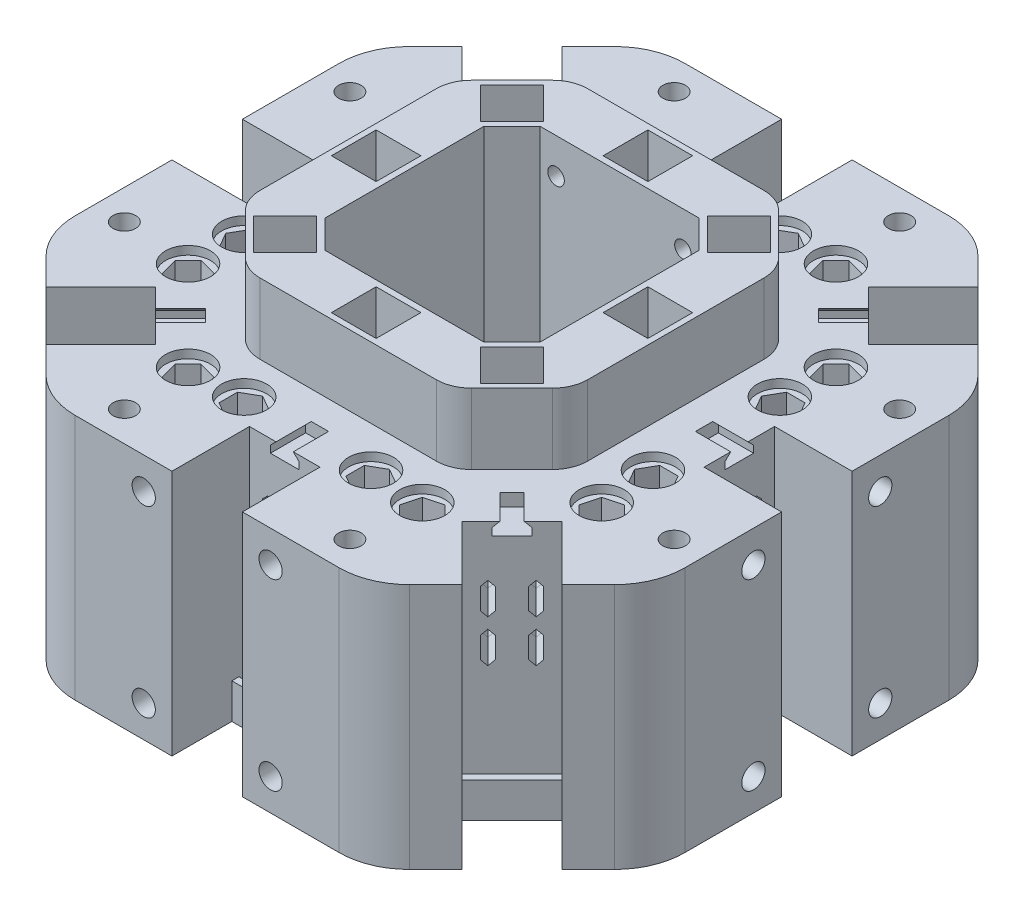
from build123d import *

# Parameters (mm, degrees)
EXTRUDE_1_DEPTH          = 35
SKETCH_4_R               = 1.375
CUT_EXTRUDE_1_DEPTH      = 71.470738608
CUT_EXTRUDE_3_DEPTH      = 5
SKETCH_9_R               = 3.19
CUT_EXTRUDE_4_DEPTH      = 1.2
SKETCH_5_W               = 10
SKETCH_5_H               = 11
SKETCH_5_W_2             = 11
SKETCH_5_H_2             = 10
CUT_EXTRUDE_2_DEPTH      = 71.470738608
EXTRUDE_2_DEPTH          = 10
SKETCH_11_W              = 6.35
SKETCH_11_H              = 6.35
CUT_EXTRUDE_5_DEPTH      = 6.5
SKETCH_12_W              = 6.35
SKETCH_12_H              = 6.35
CUT_EXTRUDE_6_DEPTH      = 6.5
SKETCH_13_W              = 4.05
SKETCH_13_H              = 1.5
SKETCH_13_H_2            = 3.5
CUT_EXTRUDE_7_DEPTH      = 1.8
EXTRUDE_3_DEPTH          = 5
EXTRUDE_4_DEPTH          = 5
PATTERN_CIRCULAR_1_COUNT = 4
PATTERN_CIRCULAR_2_COUNT = 4
CUT_EXTRUDE_9_DEPTH      = 76.935005103
EXTRUDE_5_DEPTH          = 4
CHAMFER_1_SIZE           = 2.5
SKETCH_25_R              = 1.175
CUT_EXTRUDE_11_DEPTH     = 76.935005103
SKETCH_28_R              = 1.6
CUT_EXTRUDE_13_DEPTH     = 6
SKETCH_30_R              = 1.175
CUT_EXTRUDE_14_DEPTH     = 20
SKETCH_31_R              = 2.1
CUT_EXTRUDE_15_DEPTH     = 1.5
FILLET_1_R               = 10
FILLET_2_R               = 5
SKETCH_33_R              = 1.65
CUT_EXTRUDE_16_DEPTH     = 5
PATTERN_CIRCULAR_3_COUNT = 4
SKETCH_34_W              = 10
SKETCH_34_H              = 1
EXTRUDE_6_DEPTH          = 5


with BuildPart() as part:
    # 草图3 → 凸台-拉伸1 (new body)
    with BuildSketch(Plane(origin=(0, 0, 0), x_dir=(1, 0, 0), z_dir=(0, 1, 0))):
        Polygon((43.25, -22.864484041), (22.864484041, -43.25), (-22.864484041, -43.25), (-43.25, -22.864484041), (-43.25, 22.864484041), (-22.864484041, 43.25), (22.864484041, 43.25), (43.25, 22.864484041), align=None)
    extrude(amount=EXTRUDE_1_DEPTH)

    # 草图4 → 切除-拉伸1 (cut, through all)
    with BuildSketch(Plane(origin=(0, 35, 0), x_dir=(1, 0, 0), z_dir=(0, 1, 0))):
        with Locations(Location((9, -29, 0), (0, 0, 270))):
            Circle(SKETCH_4_R)
        with Locations(Location((-9, -29, 0), (0, 0, 90))):
            Circle(SKETCH_4_R)
        with Locations(Location((29.344931419, -16.617009358, 0), (0, 0, 270))):
            Circle(SKETCH_4_R)
        with Locations(Location((16.617009358, -29.344931419, 0), (0, 0, 90))):
            Circle(SKETCH_4_R)
        with Locations(Location((-29.344931419, -16.617009358, 0), (0, 0, 90))):
            Circle(SKETCH_4_R)
        with Locations(Location((-16.617009358, -29.344931419, 0), (0, 0, 270))):
            Circle(SKETCH_4_R)
        with Locations(Location((-29, -9, 0), (0, 0, 270))):
            Circle(SKETCH_4_R)
        with Locations(Location((-29, 9, 0), (0, 0, 90))):
            Circle(SKETCH_4_R)
        with Locations(Location((-16.617009358, 29.344931419, 0), (0, 0, 90))):
            Circle(SKETCH_4_R)
        with Locations(Location((-29.344931419, 16.617009358, 0), (0, 0, 270))):
            Circle(SKETCH_4_R)
        with Locations(Location((-9, 29, 0), (0, 0, 270))):
            Circle(SKETCH_4_R)
        with Locations(Location((9, 29, 0), (0, 0, 90))):
            Circle(SKETCH_4_R)
        with Locations(Location((29.344931419, 16.617009358, 0), (0, 0, 90))):
            Circle(SKETCH_4_R)
        with Locations(Location((16.617009358, 29.344931419, 0), (0, 0, 270))):
            Circle(SKETCH_4_R)
        with Locations(Location((29, 9, 0), (0, 0, 270))):
            Circle(SKETCH_4_R)
        with Locations(Location((29, -9, 0), (0, 0, 90))):
            Circle(SKETCH_4_R)
    extrude(amount=-CUT_EXTRUDE_1_DEPTH, mode=Mode.SUBTRACT)

    # 草图8 → 切除-拉伸3 (cut)
    with BuildSketch(Plane(origin=(0, 35, 0), x_dir=(1, 0, 0), z_dir=(0, 1, 0))):
        Polygon((-6.735, -30.30769836), (-9, -31.615396719), (-11.265, -30.30769836), (-11.265, -27.69230164), (-9, -26.384603281), (-6.735, -27.69230164), align=None)
        Polygon((9, -26.384603281), (6.735, -27.69230164), (6.735, -30.30769836), (9, -31.615396719), (11.265, -30.30769836), (11.265, -27.69230164), align=None)
        Polygon((14.767644602, -27.495566663), (14.090730121, -30.021845901), (15.940094876, -31.871210657), (18.466374114, -31.194296175), (19.143288595, -28.668016938), (17.293923839, -26.818652182), align=None)
        Polygon((31.194296175, -18.466374114), (28.668016938, -19.143288595), (26.818652182, -17.293923839), (27.495566663, -14.767644602), (30.021845901, -14.090730121), (31.871210657, -15.940094876), align=None)
        Polygon((-27.69230164, 6.735), (-30.30769836, 6.735), (-31.615396719, 9), (-30.30769836, 11.265), (-27.69230164, 11.265), (-26.384603281, 9), align=None)
        Polygon((-30.30769836, -11.265), (-27.69230164, -11.265), (-26.384603281, -9), (-27.69230164, -6.735), (-30.30769836, -6.735), (-31.615396719, -9), align=None)
        Polygon((-31.194296175, -18.466374114), (-28.668016938, -19.143288595), (-26.818652182, -17.293923839), (-27.495566663, -14.767644602), (-30.021845901, -14.090730121), (-31.871210657, -15.940094876), align=None)
        Polygon((-18.466374114, -31.194296175), (-19.143288595, -28.668016938), (-17.293923839, -26.818652182), (-14.767644602, -27.495566663), (-14.090730121, -30.021845901), (-15.940094876, -31.871210657), align=None)
        Polygon((6.735, 27.69230164), (6.735, 30.30769836), (9, 31.615396719), (11.265, 30.30769836), (11.265, 27.69230164), (9, 26.384603281), align=None)
        Polygon((-11.265, 30.30769836), (-11.265, 27.69230164), (-9, 26.384603281), (-6.735, 27.69230164), (-6.735, 30.30769836), (-9, 31.615396719), align=None)
        Polygon((-18.466374114, 31.194296175), (-19.143288595, 28.668016938), (-17.293923839, 26.818652182), (-14.767644602, 27.495566663), (-14.090730121, 30.021845901), (-15.940094876, 31.871210657), align=None)
        Polygon((-31.194296175, 18.466374114), (-28.668016938, 19.143288595), (-26.818652182, 17.293923839), (-27.495566663, 14.767644602), (-30.021845901, 14.090730121), (-31.871210657, 15.940094876), align=None)
        Polygon((27.69230164, -6.735), (30.30769836, -6.735), (31.615396719, -9), (30.30769836, -11.265), (27.69230164, -11.265), (26.384603281, -9), align=None)
        Polygon((30.30769836, 11.265), (27.69230164, 11.265), (26.384603281, 9), (27.69230164, 6.735), (30.30769836, 6.735), (31.615396719, 9), align=None)
        Polygon((31.194296175, 18.466374114), (28.668016938, 19.143288595), (26.818652182, 17.293923839), (27.495566663, 14.767644602), (30.021845901, 14.090730121), (31.871210657, 15.940094876), align=None)
        Polygon((18.466374114, 31.194296175), (19.143288595, 28.668016938), (17.293923839, 26.818652182), (14.767644602, 27.495566663), (14.090730121, 30.021845901), (15.940094876, 31.871210657), align=None)
    cut_extrude_3 = extrude(amount=-CUT_EXTRUDE_3_DEPTH, mode=Mode.SUBTRACT)

    # 草图9 → 切除-拉伸4 (cut)
    with BuildSketch(Plane(origin=(0, 35, 0), x_dir=(1, 0, 0), z_dir=(0, 1, 0))):
        with Locations(Location((9, -29, 0), (0, 0, 270))):
            Circle(SKETCH_9_R)
        with Locations(Location((16.617009358, -29.344931419, 0), (0, 0, 270))):
            Circle(SKETCH_9_R)
        with Locations(Location((29, -9, 0), (0, 0, 90))):
            Circle(SKETCH_9_R)
        with Locations(Location((29.344931419, -16.617009358, 0), (0, 0, 90))):
            Circle(SKETCH_9_R)
        with Locations(Location((-16.617009358, -29.344931419, 0), (0, 0, 90))):
            Circle(SKETCH_9_R)
        with Locations(Location((-9, -29, 0), (0, 0, 90))):
            Circle(SKETCH_9_R)
        with Locations(Location((-29.344931419, -16.617009358, 0), (0, 0, 270))):
            Circle(SKETCH_9_R)
        with Locations(Location((-29, -9, 0), (0, 0, 270))):
            Circle(SKETCH_9_R)
        with Locations(Location((-29.344931419, 16.617009358, 0), (0, 0, 90))):
            Circle(SKETCH_9_R)
        with Locations(Location((-29, 9, 0), (0, 0, 90))):
            Circle(SKETCH_9_R)
        with Locations(Location((-16.617009358, 29.344931419, 0), (0, 0, 270))):
            Circle(SKETCH_9_R)
        with Locations(Location((-9, 29, 0), (0, 0, 270))):
            Circle(SKETCH_9_R)
        with Locations(Location((16.617009358, 29.344931419, 0), (0, 0, 90))):
            Circle(SKETCH_9_R)
        with Locations(Location((9, 29, 0), (0, 0, 90))):
            Circle(SKETCH_9_R)
        with Locations(Location((29.344931419, 16.617009358, 0), (0, 0, 270))):
            Circle(SKETCH_9_R)
        with Locations(Location((29, 9, 0), (0, 0, 270))):
            Circle(SKETCH_9_R)
    cut_extrude_4 = extrude(amount=-CUT_EXTRUDE_4_DEPTH, mode=Mode.SUBTRACT)

    # 草图5 → 切除-拉伸2 (cut, through all)
    with BuildSketch(Plane(origin=(0, 35, 0), x_dir=(1, 0, 0), z_dir=(0, 1, 0))):
        with Locations((0, -37.75)):
            Rectangle(SKETCH_5_W, SKETCH_5_H)
        Polygon((21.743533521, -28.814601333), (28.814601333, -21.743533521), (36.592775926, -29.521708115), (29.521708115, -36.592775926), align=None)
        Polygon((-36.592775926, -29.521708115), (-29.521708115, -36.592775926), (-21.743533521, -28.814601333), (-28.814601333, -21.743533521), align=None)
        with Locations((-37.75, 0)):
            Rectangle(SKETCH_5_W_2, SKETCH_5_H_2)
        Polygon((-29.521708115, 36.592775926), (-36.592775926, 29.521708115), (-28.814601333, 21.743533521), (-21.743533521, 28.814601333), align=None)
        with Locations((0, 37.75)):
            Rectangle(SKETCH_5_W, SKETCH_5_H)
        Polygon((36.592775926, 29.521708115), (29.521708115, 36.592775926), (21.743533521, 28.814601333), (28.814601333, 21.743533521), align=None)
        with Locations((37.75, 0)):
            Rectangle(SKETCH_5_W_2, SKETCH_5_H_2)
    extrude(amount=-CUT_EXTRUDE_2_DEPTH, mode=Mode.SUBTRACT)

    # 草图10 → 凸台-拉伸2 (add)
    with BuildSketch(Plane(origin=(0, 35, 0), x_dir=(1, 0, 0), z_dir=(0, 1, 0))):
        Polygon((23.25, -14.580212793), (14.580212793, -23.25), (-14.580212793, -23.25), (-23.25, -14.580212793), (-23.25, 14.580212793), (-14.580212793, 23.25), (14.580212793, 23.25), (23.25, 14.580212793), align=None)
    extrude(amount=EXTRUDE_2_DEPTH)

    # 草图11 → 切除-拉伸5 (cut)
    with BuildSketch(Plane(origin=(0, 45, 0), x_dir=(1, 0, 0), z_dir=(0, 1, 0))):
        with Locations((0, -19.275)):
            Rectangle(SKETCH_11_W, SKETCH_11_H)
        Polygon((11.614228881, -16.104356942), (16.104356942, -11.614228881), (20.594485002, -16.104356942), (16.104356942, -20.594485002), align=None)
        with Locations((-19.275, 0)):
            Rectangle(SKETCH_11_W, SKETCH_11_H)
        Polygon((-11.614228881, -16.104356942), (-16.104356942, -20.594485002), (-20.594485002, -16.104356942), (-16.104356942, -11.614228881), align=None)
        with Locations((0, 19.275)):
            Rectangle(SKETCH_11_W, SKETCH_11_H)
        Polygon((-16.104356942, 11.614228881), (-20.594485002, 16.104356942), (-16.104356942, 20.594485002), (-11.614228881, 16.104356942), align=None)
        with Locations((19.275, 0)):
            Rectangle(SKETCH_11_W, SKETCH_11_H)
        Polygon((11.614228881, 16.104356942), (16.104356942, 20.594485002), (20.594485002, 16.104356942), (16.104356942, 11.614228881), align=None)
    extrude(amount=-CUT_EXTRUDE_5_DEPTH, mode=Mode.SUBTRACT)

    # 镜向1: 切除-拉伸3, 切除-拉伸4 across plane
    add(cut_extrude_3.mirror(Plane.ZX.offset(17.5)), mode=Mode.SUBTRACT)
    add(cut_extrude_4.mirror(Plane.ZX.offset(17.5)), mode=Mode.SUBTRACT)

    # 草图12 → 切除-拉伸6 (cut)
    with BuildSketch(Plane.XZ):
        Polygon((11.614228881, -16.104356942), (16.104356942, -11.614228881), (20.594485002, -16.104356942), (16.104356942, -20.594485002), align=None)
        with Locations((19.275, 0)):
            Rectangle(SKETCH_12_W, SKETCH_12_H)
        Polygon((11.614228881, 16.104356942), (16.104356942, 20.594485002), (20.594485002, 16.104356942), (16.104356942, 11.614228881), align=None)
        with Locations((0, 19.275)):
            Rectangle(SKETCH_12_W, SKETCH_12_H)
        Polygon((-11.614228881, 16.104356942), (-16.104356942, 11.614228881), (-20.594485002, 16.104356942), (-16.104356942, 20.594485002), align=None)
        with Locations((-19.275, 0)):
            Rectangle(SKETCH_12_W, SKETCH_12_H)
        Polygon((-16.104356942, -11.614228881), (-11.614228881, -16.104356942), (-16.104356942, -20.594485002), (-20.594485002, -16.104356942), align=None)
        with Locations((0, -19.275)):
            Rectangle(SKETCH_12_W, SKETCH_12_H)
    extrude(amount=-CUT_EXTRUDE_6_DEPTH, mode=Mode.SUBTRACT)

    # 草图13 → 切除-拉伸7 (cut)
    with BuildSketch(Plane(origin=(0, 35, 0), x_dir=(1, 0, 0), z_dir=(0, 1, 0))):
        with Locations((0, -31.5)):
            Rectangle(SKETCH_13_W, SKETCH_13_H)
        with Locations((0, -29)):
            Rectangle(SKETCH_13_W, SKETCH_13_H_2)
        Polygon((26.710958659, -23.847176196), (23.847176196, -26.710958659), (22.786516024, -25.650298488), (25.650298488, -22.786516024), align=None)
        Polygon((22.786516024, -25.650298488), (25.650298488, -22.786516024), (23.175424753, -20.31164229), (20.31164229, -23.175424753), align=None)
    cut_extrude_7 = extrude(amount=-CUT_EXTRUDE_7_DEPTH, mode=Mode.SUBTRACT)

    # 草图22 → 凸台-拉伸3 (add)
    with BuildSketch(Plane.XY.offset(32.25)):
        Polygon((2.025, 35), (2.025, 34.2), (1.225, 35), align=None)
        Polygon((-1.225, 35), (-2.025, 35), (-2.025, 34.2), align=None)
    extrude_3 = extrude(amount=-EXTRUDE_3_DEPTH)

    # 草图23 → 凸台-拉伸4 (add)
    with BuildSketch(Plane(origin=(25.279067427, 0, 25.279067427), x_dir=(0.7071067811865475, 0, -0.7071067811865477), z_dir=(0.7071067811865477, 0, 0.7071067811865475))):
        Polygon((2.025, 35), (2.025, 34.2), (1.225, 35), align=None)
        Polygon((-1.225, 35), (-2.025, 35), (-2.025, 34.2), align=None)
    extrude_4 = extrude(amount=-EXTRUDE_4_DEPTH)

    # 阵列(圆周)1: 切除-拉伸7, 凸台-拉伸3, 凸台-拉伸4 ×4 about axis
    pattern_circular_1_axis = Axis((0, 0, 0), (0, 1, 0))
    add([cut_extrude_7.rotate(pattern_circular_1_axis, i * 360 / PATTERN_CIRCULAR_1_COUNT) for i in range(1, PATTERN_CIRCULAR_1_COUNT)], mode=Mode.SUBTRACT)
    add([extrude_3.rotate(pattern_circular_1_axis, i * 360 / PATTERN_CIRCULAR_1_COUNT) for i in range(1, PATTERN_CIRCULAR_1_COUNT)])
    add([extrude_4.rotate(pattern_circular_1_axis, i * 360 / PATTERN_CIRCULAR_1_COUNT) for i in range(1, PATTERN_CIRCULAR_1_COUNT)])

    # 切除-扫描1: sweep along a path in 草图16
    with BuildLine(Plane(origin=(0, 0, 0), x_dir=(0, 0, -1), z_dir=(1, 0, 0))) as sweep_1_path:
        Line((-19.275, 38.5), (-19.275, 33.5))
        ThreePointArc((-19.275, 33.5), (-21.618145751, 27.843145751), (-27.275, 25.5))
        Line((-27.275, 25.5), (-32.25, 25.5))
    # 草图15 → 切除-扫描1 (sweep, cut)
    with BuildSketch(Plane(origin=(0, 38.5, 0), x_dir=(1, 0, 0), z_dir=(0, 1, 0))):
        Polygon((1.675, -20.775), (1.675, -17.775), (2.425, -17.025), (3.175, -17.775), (3.175, -20.775), (2.425, -21.525), align=None)
        Polygon((-2.425, -17.025), (-3.175, -17.775), (-3.175, -20.775), (-2.425, -21.525), (-1.675, -20.775), (-1.675, -17.775), align=None)
    sweep_1 = sweep(path=sweep_1_path.line, mode=Mode.SUBTRACT)

    # 切除-扫描2: sweep along a path in 草图18
    with BuildLine(Plane(origin=(0, 0, 0), x_dir=(0.7071067811865478, 0, 0.7071067811865474), z_dir=(-0.7071067811865474, 0, 0.7071067811865478))) as sweep_2_path:
        Line((22.775, 38.5), (22.775, 33.5))
        ThreePointArc((22.775, 33.5), (25.118145751, 27.843145751), (30.775, 25.5))
        Line((30.775, 25.5), (35.75, 25.5))
    # 草图17 → 切除-扫描2 (sweep, cut)
    with BuildSketch(Plane(origin=(0, 38.5, 0), x_dir=(1, 0, 0), z_dir=(0, 1, 0))):
        Polygon((18.349420972, -15.980613255), (16.228100628, -13.859292911), (16.228100628, -12.798632739), (17.2887608, -12.798632739), (19.410081144, -14.919953083), (19.410081144, -15.980613255), align=None)
        Polygon((15.980613255, -18.349420972), (15.980613255, -19.410081144), (14.919953083, -19.410081144), (12.798632739, -17.2887608), (12.798632739, -16.228100628), (13.859292911, -16.228100628), align=None)
    sweep_2 = sweep(path=sweep_2_path.line, mode=Mode.SUBTRACT)

    # 阵列(圆周)2: 切除-扫描1, 切除-扫描2 ×4 about axis
    pattern_circular_2_axis = Axis((0, 0, 0), (0, 1, 0))
    add([sweep_1.rotate(pattern_circular_2_axis, i * 360 / PATTERN_CIRCULAR_2_COUNT) for i in range(1, PATTERN_CIRCULAR_2_COUNT)], mode=Mode.SUBTRACT)
    add([sweep_2.rotate(pattern_circular_2_axis, i * 360 / PATTERN_CIRCULAR_2_COUNT) for i in range(1, PATTERN_CIRCULAR_2_COUNT)], mode=Mode.SUBTRACT)

    # 镜向2: 切除-扫描1, 切除-扫描2 across plane
    add(sweep_1.mirror(Plane.ZX.offset(22.5)), mode=Mode.SUBTRACT)
    add(sweep_2.mirror(Plane.ZX.offset(22.5)), mode=Mode.SUBTRACT)

    # 镜向2 copy 1: sweep along a path in 镜向2 copy 1 path
    with BuildLine(Plane(origin=(0, 45, 0), x_dir=(-1, 0, 0), z_dir=(0, 0, -1))) as mirror_2_copy_1_path:
        Line((-19.275, -38.5), (-19.275, -33.5))
        ThreePointArc((-19.275, -33.5), (-21.618145751, -27.843145751), (-27.275, -25.5))
        Line((-27.275, -25.5), (-32.25, -25.5))
    # 镜向2 copy 1 sketch → 镜向2 copy 1 (sweep, cut)
    with BuildSketch(Plane(origin=(0, 6.5, 0), x_dir=(0, 0, -1), z_dir=(0, -1, 0))):
        Polygon((1.675, 20.775), (1.675, 17.775), (2.425, 17.025), (3.175, 17.775), (3.175, 20.775), (2.425, 21.525), align=None)
        Polygon((-2.425, 17.025), (-3.175, 17.775), (-3.175, 20.775), (-2.425, 21.525), (-1.675, 20.775), (-1.675, 17.775), align=None)
    sweep(path=mirror_2_copy_1_path.line, mode=Mode.SUBTRACT)

    # 镜向2 copy 2: sweep along a path in 镜向2 copy 2 path
    with BuildLine(Plane(origin=(0, 45, 0), x_dir=(0, 0, 1), z_dir=(-1, 0, 0))) as mirror_2_copy_2_path:
        Line((-19.275, -38.5), (-19.275, -33.5))
        ThreePointArc((-19.275, -33.5), (-21.618145751, -27.843145751), (-27.275, -25.5))
        Line((-27.275, -25.5), (-32.25, -25.5))
    # 镜向2 copy 2 sketch → 镜向2 copy 2 (sweep, cut)
    with BuildSketch(Plane(origin=(0, 6.5, 0), x_dir=(-1, 0, 0), z_dir=(0, -1, 0))):
        Polygon((1.675, 20.775), (1.675, 17.775), (2.425, 17.025), (3.175, 17.775), (3.175, 20.775), (2.425, 21.525), align=None)
        Polygon((-2.425, 17.025), (-3.175, 17.775), (-3.175, 20.775), (-2.425, 21.525), (-1.675, 20.775), (-1.675, 17.775), align=None)
    sweep(path=mirror_2_copy_2_path.line, mode=Mode.SUBTRACT)

    # 镜向2 copy 3: sweep along a path in 镜向2 copy 3 path
    with BuildLine(Plane(origin=(0, 45, 0), x_dir=(1, 0, 0), z_dir=(0, 0, 1))) as mirror_2_copy_3_path:
        Line((-19.275, -38.5), (-19.275, -33.5))
        ThreePointArc((-19.275, -33.5), (-21.618145751, -27.843145751), (-27.275, -25.5))
        Line((-27.275, -25.5), (-32.25, -25.5))
    # 镜向2 copy 3 sketch → 镜向2 copy 3 (sweep, cut)
    with BuildSketch(Plane(origin=(0, 6.5, 0), x_dir=(0, 0, 1), z_dir=(0, -1, 0))):
        Polygon((1.675, 20.775), (1.675, 17.775), (2.425, 17.025), (3.175, 17.775), (3.175, 20.775), (2.425, 21.525), align=None)
        Polygon((-2.425, 17.025), (-3.175, 17.775), (-3.175, 20.775), (-2.425, 21.525), (-1.675, 20.775), (-1.675, 17.775), align=None)
    sweep(path=mirror_2_copy_3_path.line, mode=Mode.SUBTRACT)

    # 镜向2 copy 4: sweep along a path in 镜向2 copy 4 path
    with BuildLine(Plane(origin=(0, 45, 0), x_dir=(0.7071067811865474, 0, -0.7071067811865478), z_dir=(0.7071067811865478, 0, 0.7071067811865474))) as mirror_2_copy_4_path:
        Line((22.775, -38.5), (22.775, -33.5))
        ThreePointArc((22.775, -33.5), (25.118145751, -27.843145751), (30.775, -25.5))
        Line((30.775, -25.5), (35.75, -25.5))
    # 镜向2 copy 4 sketch → 镜向2 copy 4 (sweep, cut)
    with BuildSketch(Plane(origin=(0, 6.5, 0), x_dir=(0, 0, -1), z_dir=(0, -1, 0))):
        Polygon((18.349420972, 15.980613255), (16.228100628, 13.859292911), (16.228100628, 12.798632739), (17.2887608, 12.798632739), (19.410081144, 14.919953083), (19.410081144, 15.980613255), align=None)
        Polygon((15.980613255, 18.349420972), (15.980613255, 19.410081144), (14.919953083, 19.410081144), (12.798632739, 17.2887608), (12.798632739, 16.228100628), (13.859292911, 16.228100628), align=None)
    sweep(path=mirror_2_copy_4_path.line, mode=Mode.SUBTRACT)

    # 镜向2 copy 5: sweep along a path in 镜向2 copy 5 path
    with BuildLine(Plane(origin=(0, 45, 0), x_dir=(-0.7071067811865477, 0, -0.7071067811865475), z_dir=(0.7071067811865475, 0, -0.7071067811865477))) as mirror_2_copy_5_path:
        Line((22.775, -38.5), (22.775, -33.5))
        ThreePointArc((22.775, -33.5), (25.118145751, -27.843145751), (30.775, -25.5))
        Line((30.775, -25.5), (35.75, -25.5))
    # 镜向2 copy 5 sketch → 镜向2 copy 5 (sweep, cut)
    with BuildSketch(Plane(origin=(0, 6.5, 0), x_dir=(-1, 0, 0), z_dir=(0, -1, 0))):
        Polygon((18.349420972, 15.980613255), (16.228100628, 13.859292911), (16.228100628, 12.798632739), (17.2887608, 12.798632739), (19.410081144, 14.919953083), (19.410081144, 15.980613255), align=None)
        Polygon((15.980613255, 18.349420972), (15.980613255, 19.410081144), (14.919953083, 19.410081144), (12.798632739, 17.2887608), (12.798632739, 16.228100628), (13.859292911, 16.228100628), align=None)
    sweep(path=mirror_2_copy_5_path.line, mode=Mode.SUBTRACT)

    # 镜向2 copy 6: sweep along a path in 镜向2 copy 6 path
    with BuildLine(Plane(origin=(0, 45, 0), x_dir=(-0.7071067811865475, 0, 0.7071067811865477), z_dir=(-0.7071067811865477, 0, -0.7071067811865475))) as mirror_2_copy_6_path:
        Line((22.775, -38.5), (22.775, -33.5))
        ThreePointArc((22.775, -33.5), (25.118145751, -27.843145751), (30.775, -25.5))
        Line((30.775, -25.5), (35.75, -25.5))
    # 镜向2 copy 6 sketch → 镜向2 copy 6 (sweep, cut)
    with BuildSketch(Plane(origin=(0, 6.5, 0), x_dir=(0, 0, 1), z_dir=(0, -1, 0))):
        Polygon((18.349420972, 15.980613255), (16.228100628, 13.859292911), (16.228100628, 12.798632739), (17.2887608, 12.798632739), (19.410081144, 14.919953083), (19.410081144, 15.980613255), align=None)
        Polygon((15.980613255, 18.349420972), (15.980613255, 19.410081144), (14.919953083, 19.410081144), (12.798632739, 17.2887608), (12.798632739, 16.228100628), (13.859292911, 16.228100628), align=None)
    sweep(path=mirror_2_copy_6_path.line, mode=Mode.SUBTRACT)

    # 草图20 → 切除-拉伸9 (cut, through all)
    with BuildSketch(Plane(origin=(0, 45, 0), x_dir=(1, 0, 0), z_dir=(0, 1, 0))):
        Polygon((-15.25, 11.266504294), (-11.266504294, 15.25), (11.266504294, 15.25), (15.25, 11.266504294), (15.25, -11.266504294), (11.266504294, -15.25), (-11.266504294, -15.25), (-15.25, -11.266504294), align=None)
    extrude(amount=-CUT_EXTRUDE_9_DEPTH, mode=Mode.SUBTRACT)

    # 草图24 → 凸台-拉伸5 (add)
    with BuildSketch(Plane.XZ):
        Polygon((7.25, 7.25), (15.25, 7.25), (15.25, 11.266504294), (11.266504294, 15.25), (7.25, 15.25), align=None)
        Polygon((7.25, -7.25), (7.25, -15.25), (11.266504294, -15.25), (15.25, -11.266504294), (15.25, -7.25), align=None)
        Polygon((-7.25, -7.25), (-15.25, -7.25), (-15.25, -11.266504294), (-11.266504294, -15.25), (-7.25, -15.25), align=None)
        Polygon((-7.25, 7.25), (-7.25, 15.25), (-11.266504294, 15.25), (-15.25, 11.266504294), (-15.25, 7.25), align=None)
    extrude(amount=-EXTRUDE_5_DEPTH)

    # 倒角1
    chamfer_1_edges = [part.edges().sort_by_distance(p)[0] for p in [
        (7.25, 2, 7.25),
        (7.25, 2, -7.25),
        (-7.25, 2, -7.25),
        (-7.25, 2, 7.25),
    ]]
    chamfer(chamfer_1_edges, length=CHAMFER_1_SIZE)

    # 草图25 → 切除-拉伸11 (cut, through all)
    with BuildSketch(Plane.XZ):
        with Locations(Location((11, -11, 0), (0, 0, 270))):
            Circle(SKETCH_25_R)
        with Locations(Location((-11, -11, 0), (0, 0, 270))):
            Circle(SKETCH_25_R)
        with Locations(Location((-11, 11, 0), (0, 0, 270))):
            Circle(SKETCH_25_R)
        with Locations(Location((11, 11, 0), (0, 0, 270))):
            Circle(SKETCH_25_R)
    extrude(amount=-CUT_EXTRUDE_11_DEPTH, mode=Mode.SUBTRACT)

    # 草图28 → 切除-拉伸13 (cut)
    with BuildSketch(Plane.XZ):
        with Locations(Location((16, -39, 0), (0, 0, 270))):
            Circle(SKETCH_28_R)
        with Locations(Location((39, -16, 0), (0, 0, 90))):
            Circle(SKETCH_28_R)
        with Locations(Location((-39, -16, 0), (0, 0, 270))):
            Circle(SKETCH_28_R)
        with Locations(Location((-16, -39, 0), (0, 0, 90))):
            Circle(SKETCH_28_R)
        with Locations(Location((-16, 39, 0), (0, 0, 270))):
            Circle(SKETCH_28_R)
        with Locations(Location((-39, 16, 0), (0, 0, 90))):
            Circle(SKETCH_28_R)
        with Locations(Location((39, 16, 0), (0, 0, 270))):
            Circle(SKETCH_28_R)
        with Locations(Location((16, 39, 0), (0, 0, 90))):
            Circle(SKETCH_28_R)
    cut_extrude_13 = extrude(amount=-CUT_EXTRUDE_13_DEPTH, mode=Mode.SUBTRACT)

    # 镜向3: 切除-拉伸13 across plane
    add(cut_extrude_13.mirror(Plane.ZX.offset(17.5)), mode=Mode.SUBTRACT)

    # 草图30 → 切除-拉伸14 (cut)
    with BuildSketch(Plane(origin=(0, 0, -23.25), x_dir=(-1, 0, 0), z_dir=(0, 0, -1))):
        with Locations((9, 40)):
            Circle(SKETCH_30_R)
        with Locations((-9, 40)):
            Circle(SKETCH_30_R)
    extrude(amount=-CUT_EXTRUDE_14_DEPTH, mode=Mode.SUBTRACT)

    # 草图31 → 切除-拉伸15 (cut)
    with BuildSketch(Plane(origin=(0, 0, -23.25), x_dir=(-1, 0, 0), z_dir=(0, 0, -1))):
        with Locations((9, 40)):
            Circle(SKETCH_31_R)
        with Locations((-9, 40)):
            Circle(SKETCH_31_R)
    extrude(amount=-CUT_EXTRUDE_15_DEPTH, mode=Mode.SUBTRACT)

    # 圆角1
    fillet_1_edges = [part.edges().sort_by_distance(p)[0] for p in [
        (43.25, 17.5, 22.864484041),
        (22.864484041, 17.5, 43.25),
        (-22.864484041, 17.5, 43.25),
        (-43.25, 17.5, 22.864484041),
        (-43.25, 17.5, -22.864484041),
        (-22.864484041, 17.5, -43.25),
        (22.864484041, 17.5, -43.25),
        (43.25, 17.5, -22.864484041),
    ]]
    fillet(fillet_1_edges, radius=FILLET_1_R)

    # 圆角2
    fillet_2_edges = [part.edges().sort_by_distance(p)[0] for p in [
        (23.25, 40, 14.580212793),
        (23.25, 40, -14.580212793),
        (14.580212793, 40, -23.25),
        (-14.580212793, 40, -23.25),
        (-23.25, 40, -14.580212793),
        (-23.25, 40, 14.580212793),
        (-14.580212793, 40, 23.25),
        (14.580212793, 40, 23.25),
    ]]
    fillet(fillet_2_edges, radius=FILLET_2_R)

    # 草图33 → 切除-拉伸16 (cut)
    with BuildSketch(Plane.ZY.offset(43.25)):
        with Locations((9, 30.5)):
            Circle(SKETCH_33_R)
        with Locations(Location((9, 4.5, 0), (0, 0, 180))):
            Circle(SKETCH_33_R)
        with Locations((-9, 4.5)):
            Circle(SKETCH_33_R)
        with Locations(Location((-9, 30.5, 0), (0, 0, 180))):
            Circle(SKETCH_33_R)
    cut_extrude_16 = extrude(amount=-CUT_EXTRUDE_16_DEPTH, mode=Mode.SUBTRACT)

    # 阵列(圆周)3: 切除-拉伸16 ×4 about axis
    pattern_circular_3_axis = Axis((0, 0, 0), (0, 1, 0))
    for i in range(1, PATTERN_CIRCULAR_3_COUNT):
        add(cut_extrude_16.rotate(pattern_circular_3_axis, i * 360 / PATTERN_CIRCULAR_3_COUNT), mode=Mode.SUBTRACT)

    # 草图34 → 凸台-拉伸6 (add)
    with BuildSketch(Plane.XZ):
        with Locations((0, 34.25)):
            Rectangle(SKETCH_34_W, SKETCH_34_H)
        Polygon((22.804193693, 29.875261505), (29.875261505, 22.804193693), (30.582368286, 23.511300474), (23.511300474, 30.582368286), align=None)
    extrude(amount=-EXTRUDE_6_DEPTH)


solid = part.part
